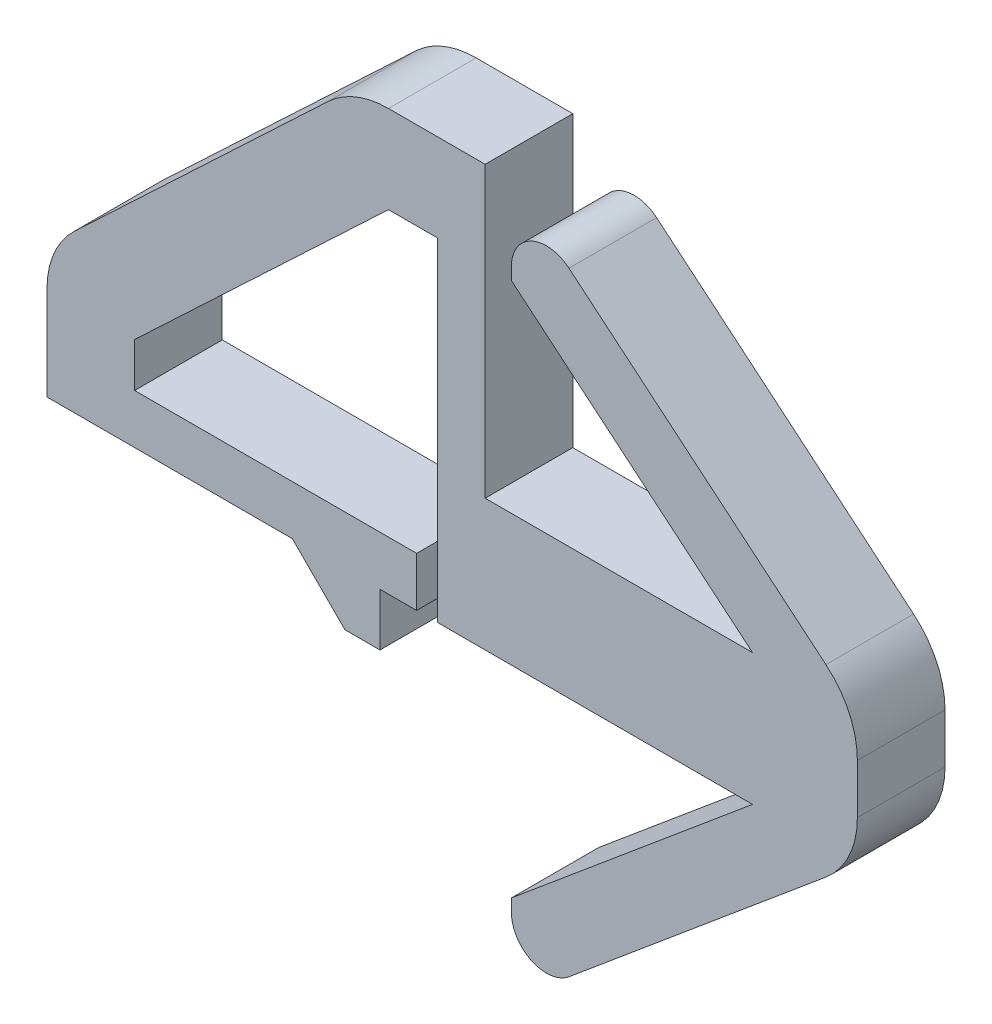
from build123d import *

# Parameters (mm, degrees)
BOSS_EXTRUDE1_DEPTH = 2
FILLET1_R           = 0.8
FILLET2_R           = 2
CUT_EXTRUDE1_DEPTH  = 15.121515427
CHAMFER1_SIZE       = 1.2


with BuildPart() as part:
    # Sketch1 → Boss-Extrude1 (new body)
    with BuildSketch(Plane.XY):
        Polygon((5.802857873, 2.85130668), (0.3, 7.45130668), (0.3, 9.45130668), (8.195404775, 2.85130668), (8.195404775, -0.14869332), (0.3, -6.74869332), (0.3, -4.74869332), (5.802857873, -0.14869332), (-2.7, -0.14869332), (-2.7, -1.34869332), (-4.7, -1.34869332), (-4.7, -0.14869332), (-10.3, -0.14869332), (-10.3, 2.85130668), (-3.3, 9.45130668), (-0.3, 9.45130668), (-0.3, 2.85130668), align=None)
    extrude(amount=BOSS_EXTRUDE1_DEPTH)

    # Fillet1
    fillet1_edges = [part.edges().sort_by_distance(p)[0] for p in [
        (0.3, 9.45130668, 1),
        (0.3, -6.74869332, 1),
    ]]
    fillet(fillet1_edges, radius=FILLET1_R)

    # Fillet2
    fillet2_edges = [part.edges().sort_by_distance(p)[0] for p in [
        (-10.3, 2.85130668, 1),
        (-3.3, 9.45130668, 1),
        (8.195404775, 2.85130668, 1),
        (8.195404775, -0.14869332, 1),
    ]]
    fillet(fillet2_edges, radius=FILLET2_R)

    # Sketch2 → Cut-Extrude1 (cut, through all)
    with BuildSketch(Plane.XY.offset(2)):
        Polygon((-1.383139325, 7.45130668), (-1.383139325, -0.14869332), (-1.863442011, -0.14869332), (-1.863442011, 0.979922786), (-8.3, 0.979922786), (-8.3, 1.988217887), (-2.505814916, 7.45130668), align=None)
    extrude(amount=-CUT_EXTRUDE1_DEPTH, mode=Mode.SUBTRACT)

    # Chamfer1
    chamfer1_edges = [part.edges().sort_by_distance(p)[0] for p in [
        (-4.7, -1.34869332, 1),
    ]]
    chamfer(chamfer1_edges, length=CHAMFER1_SIZE - 0.0001)  # a hair under: the kernel refuses the full size


solid = part.part
